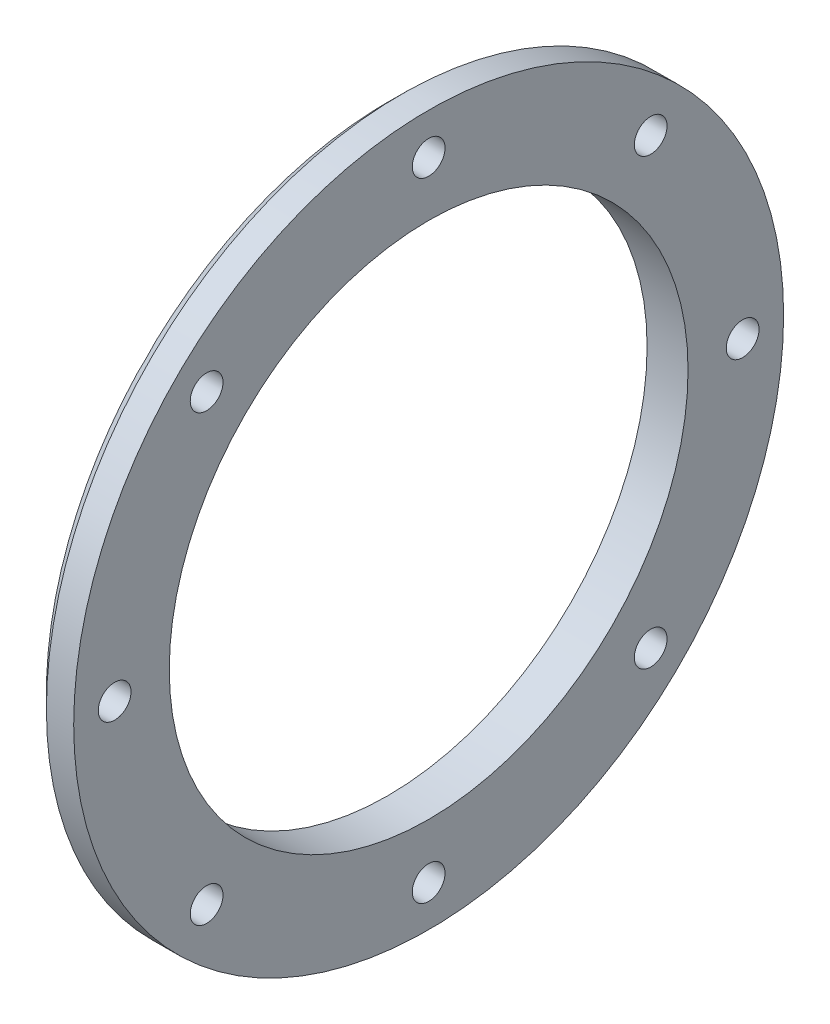
from build123d import *

# Parameters (mm, degrees)
HOLE_WIZARD_M21_D           = 2.4
HOLE_WIZARD_M21_CSINK_D     = 4.4
HOLE_WIZARD_M21_CSINK_ANGLE = 90
PATTERN_CIRCULAR_1_COUNT    = 8


with BuildPart() as part:
    # Эскиз1 → Повернуть1 (revolve)
    with BuildSketch(Plane.XY):
        Polygon((0, 19), (0, 25), (1, 26), (3, 26), (3, 19), align=None)
    revolve(axis=Axis((0, 0, 0), (1, 0, 0)))

    # Зенковка для винта с потайной головкой M21 (through all)
    with Locations(Plane.ZY):
        with Locations((16.263455967, 16.263455967)):
            hole_wizard_m21 = CounterSinkHole(HOLE_WIZARD_M21_D / 2, HOLE_WIZARD_M21_CSINK_D / 2, counter_sink_angle=HOLE_WIZARD_M21_CSINK_ANGLE)

    # Круговой массив1: Зенковка для винта с потайной головкой M21 ×8 about axis
    pattern_circular_1_axis = Axis((1, 0, 0), (-1, 0, 0))
    for i in range(1, PATTERN_CIRCULAR_1_COUNT):
        add(hole_wizard_m21.rotate(pattern_circular_1_axis, i * 360 / PATTERN_CIRCULAR_1_COUNT), mode=Mode.SUBTRACT)


solid = part.part
